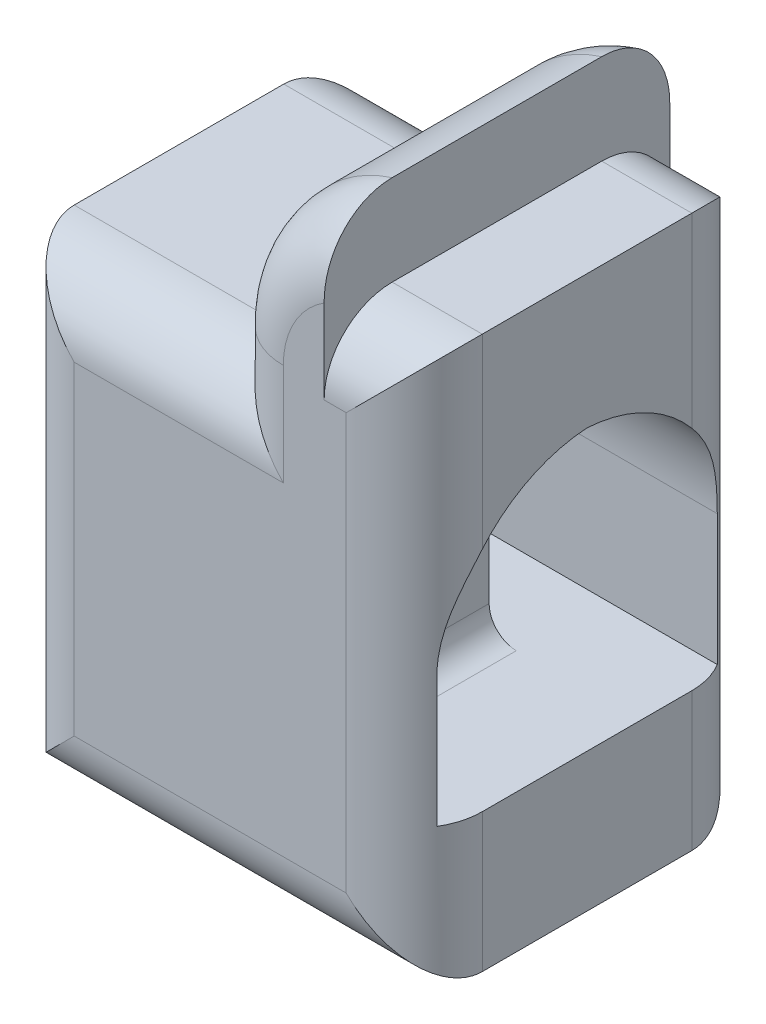
from build123d import *

# Parameters (mm, degrees)
BOSS_EXTRUDE1_DEPTH = 63.5
SKETCH3_W           = 103
SKETCH3_H           = 103
CUT_EXTRUDE1_DEPTH  = 211.692895559
BOSS_EXTRUDE2_DEPTH = 20
FILLET1_R           = 55
SKETCH6_R           = 10
CUT_EXTRUDE2_DEPTH  = 176.866755526
FILLET2_R           = 10
FILLET3_R           = 25


with BuildPart() as part:
    # Sketch2 → Boss-Extrude1 (new, symmetric)
    with BuildSketch(Plane.XY):
        with BuildLine():
            Line((-37.021158778, -102.394460884), (112.91726901, -102.394460884))
            Line((112.91726901, -102.394460884), (112.91726901, 63.318112544))
            Line((112.91726901, 63.318112544), (112.91726901, 100.457569387))
            Line((112.91726901, 100.457569387), (79.814777063, 100.457569387))
            Line((79.814777063, 100.457569387), (79.814777063, 133.707569387))
            ThreePointArc((79.814777063, 133.707569387), (50.885133933, 112.867809308), (39.821527553, 78.973614146))
            Line((39.821527553, 78.973614146), (39.821527553, 66.568112544))
            Line((39.821527553, 66.568112544), (-37.021158778, 66.568112544))
            Line((-37.021158778, 66.568112544), (-37.021158778, -102.394460884))
        make_face()
    extrude(amount=BOSS_EXTRUDE1_DEPTH, both=True)

    # Sketch3 → Cut-Extrude1 (cut, through all)
    with BuildSketch(Plane(origin=(112.91726901, 0, 0), x_dir=(0, 0, -1), z_dir=(1, 0, 0))):
        Rectangle(SKETCH3_W, SKETCH3_H)
    extrude(amount=-CUT_EXTRUDE1_DEPTH, mode=Mode.SUBTRACT)

    # Sketch5 → Boss-Extrude2 (add, symmetric)
    with BuildSketch(Plane.ZY.offset(-37.948055116)):
        with BuildLine():
            Line((19, -51.5), (-19, -51.5))
            Line((-19, -51.5), (-19, -21.5))
            ThreePointArc((-19, -21.5), (0, -2.5), (19, -21.5))
            Line((19, -21.5), (19, -51.5))
        make_face()
    extrude(amount=BOSS_EXTRUDE2_DEPTH, both=True)

    # Fillet1
    # the kernel refuses this fillet: 55 mm, written as the material it adds along each edge
    with BuildSketch(Plane(origin=(112.91726901, 51.5, 51.5), x_dir=(0, 0, -1), z_dir=(-1, 0, 0))) as fillet1_piece_1:
        with BuildLine():
            CenterArc((FILLET1_R, FILLET1_R), FILLET1_R, 180, 90)
            Line((0, FILLET1_R), (0, 0))
            Line((0, 0), (FILLET1_R, 0))
        make_face()
    extrude(amount=149.938427788)
    with BuildSketch(Plane(origin=(112.91726901, 51.5, -51.5), x_dir=(0, 0, 1), z_dir=(-1, 0, 0))) as fillet1_piece_2:
        with BuildLine():
            CenterArc((FILLET1_R, -FILLET1_R), FILLET1_R, 90, 90)
            Line((0, -FILLET1_R), (0, 0))
            Line((0, 0), (FILLET1_R, 0))
        make_face()
    extrude(amount=149.938427788)

    # Sketch6 → Cut-Extrude2 (cut, through all)
    with BuildSketch(Plane.ZY.offset(-17.948055116)):
        with Locations((0, -21.5)):
            Circle(SKETCH6_R)
    extrude(amount=-CUT_EXTRUDE2_DEPTH, mode=Mode.SUBTRACT)

    # Fillet2
    fillet2_edges = [part.edges().sort_by_distance(p)[0] for p in [
        (57.948055116, -51.5, 0),
        (17.948055116, -51.5, 0),
    ]]
    fillet(fillet2_edges, radius=FILLET2_R)

    # Fillet3
    # the kernel refuses this fillet: 25 mm, written as the material it takes off along each edge
    with BuildSketch(Plane(origin=(39.821527553, 78.973614146, -63.5), x_dir=(0, 0, 1), z_dir=(0, -1, 0)), Plane(origin=(39.821527553, 78.973614146, 63.5), x_dir=(1, 0, 0), z_dir=(0, -1, 0))) as fillet3_piece_1:
        with BuildLine():
            CenterArc((FILLET3_R, -FILLET3_R), FILLET3_R, 90, 90)
            Line((0, -FILLET3_R), (0, 0))
            Line((0, 0), (FILLET3_R, 0))
        make_face()
    extrude(amount=12.405501602, mode=Mode.SUBTRACT)
    with BuildSketch(Plane(origin=(97.272046317, 78.973614146, -63.5), x_dir=(0.7028717188946543, 0.711316629060557, 0), z_dir=(0.711316629060557, -0.7028717188946543, 0))) as fillet3_piece_2:
        with BuildLine():
            CenterArc((57.450518764 - FILLET3_R, FILLET3_R), FILLET3_R, 270, 90)
            Line((57.450518764 - FILLET3_R, 0), (57.450518764, 0))
            Line((57.450518764, 0), (57.450518764, FILLET3_R))
        make_face()
    revolve(axis=Axis((97.272046317, 78.973614146, -63.5), (0, 0, 1)), revolution_arc=134.657858898, mode=Mode.SUBTRACT)
    with BuildSketch(Plane(origin=(-99.521158778, -102.394460884, 63.5), x_dir=(0, 0, -1), z_dir=(1, 0, 0))) as fillet3_piece_3:
        with BuildLine():
            CenterArc((FILLET3_R, FILLET3_R), FILLET3_R, 180, 90)
            Line((0, FILLET3_R), (0, 0))
            Line((0, 0), (FILLET3_R, 0))
        make_face()
    extrude(amount=274.938427788, mode=Mode.SUBTRACT)
    with BuildSketch(Plane(origin=(97.272046317, 78.973614146, 63.5), x_dir=(0.7028717188946543, 0.711316629060557, 0), z_dir=(0.711316629060557, -0.7028717188946543, 0))) as fillet3_piece_4:
        with BuildLine():
            CenterArc((57.450518764 - FILLET3_R, -FILLET3_R), FILLET3_R, 0, 90)
            Line((57.450518764, -FILLET3_R), (57.450518764, 0))
            Line((57.450518764, 0), (57.450518764 - FILLET3_R, 0))
        make_face()
    revolve(axis=Axis((97.272046317, 78.973614146, 63.5), (0, 0, 1)), revolution_arc=134.657858898, mode=Mode.SUBTRACT)
    with BuildSketch(Plane(origin=(39.821527553, 66.568112544, 63.5), x_dir=(0, -1, 0), z_dir=(-1, 0, 0)), Plane(origin=(39.821527553, 66.568112544, -63.5), x_dir=(0, 0, 1), z_dir=(-1, 0, 0))) as fillet3_piece_5:
        with BuildLine():
            CenterArc((FILLET3_R, -FILLET3_R), FILLET3_R, 90, 90)
            Line((0, -FILLET3_R), (0, 0))
            Line((0, 0), (FILLET3_R, 0))
        make_face()
    extrude(amount=139.342686331, mode=Mode.SUBTRACT)
    with BuildSketch(Plane(origin=(-37.021158778, 129.068112544, 63.5), x_dir=(0, 0, -1), z_dir=(0, -1, 0))) as fillet3_piece_6:
        with BuildLine():
            CenterArc((FILLET3_R, FILLET3_R), FILLET3_R, 180, 90)
            Line((0, FILLET3_R), (0, 0))
            Line((0, 0), (FILLET3_R, 0))
        make_face()
    extrude(amount=293.962573428, mode=Mode.SUBTRACT)
    with BuildSketch(Plane(origin=(112.91726901, 162.957569387, 63.5), x_dir=(-1, 0, 0), z_dir=(0, -1, 0)), Plane(origin=(112.91726901, -164.894460884, -63.5), x_dir=(-1, 0, 0), z_dir=(0, 1, 0))) as fillet3_piece_7:
        with BuildLine():
            CenterArc((FILLET3_R, FILLET3_R), FILLET3_R, 180, 90)
            Line((0, FILLET3_R), (0, 0))
            Line((0, 0), (FILLET3_R, 0))
        make_face()
    extrude(amount=327.852030272, mode=Mode.SUBTRACT)
    with BuildSketch(Plane(origin=(-99.521158778, -102.394460884, -63.5), x_dir=(0, 0, 1), z_dir=(1, 0, 0))) as fillet3_piece_8:
        with BuildLine():
            CenterArc((FILLET3_R, -FILLET3_R), FILLET3_R, 90, 90)
            Line((0, -FILLET3_R), (0, 0))
            Line((0, 0), (FILLET3_R, 0))
        make_face()
    extrude(amount=274.938427788, mode=Mode.SUBTRACT)
    with BuildSketch(Plane(origin=(-37.021158778, 129.068112544, -63.5), x_dir=(0, 0, 1), z_dir=(0, -1, 0))) as fillet3_piece_9:
        with BuildLine():
            CenterArc((FILLET3_R, -FILLET3_R), FILLET3_R, 90, 90)
            Line((0, -FILLET3_R), (0, 0))
            Line((0, 0), (FILLET3_R, 0))
        make_face()
    extrude(amount=293.962573428, mode=Mode.SUBTRACT)
    with BuildSketch(Plane(origin=(175.41726901, 100.457569387, -63.5), x_dir=(0, 0, 1), z_dir=(-1, 0, 0)), Plane(origin=(175.41726901, 100.457569387, 63.5), x_dir=(0, -1, 0), z_dir=(-1, 0, 0))) as fillet3_piece_10:
        with BuildLine():
            CenterArc((FILLET3_R, -FILLET3_R), FILLET3_R, 90, 90)
            Line((0, -FILLET3_R), (0, 0))
            Line((0, 0), (FILLET3_R, 0))
        make_face()
    extrude(amount=95.602491947, mode=Mode.SUBTRACT)
    with BuildSketch(Plane(origin=(39.821527553, 78.973614146, -63.5), x_dir=(0, 0, 1), z_dir=(0, -1, 0))) as fillet3_piece_11a_section:
        with BuildLine():
            CenterArc((FILLET3_R, -FILLET3_R), FILLET3_R, 90, 90)
            Line((0, -FILLET3_R), (0, 0))
            Line((0, 0), (FILLET3_R, 0))
        make_face()
    fillet3_piece_11a = extrude(amount=74.905501602, mode=Mode.PRIVATE)
    fillet3_piece_11a = split(fillet3_piece_11a, bisect_by=Plane(origin=(45.48140541, 66.568112544, -57.840122143), z_dir=(0, -1, 0)), keep=Keep.TOP, mode=Mode.PRIVATE)
    with BuildSketch(Plane(origin=(102.321527553, 66.568112544, -63.5), x_dir=(0, 0, 1), z_dir=(-1, 0, 0))) as fillet3_piece_11b_section:
        with BuildLine():
            CenterArc((FILLET3_R, -FILLET3_R), FILLET3_R, 90, 90)
            Line((0, -FILLET3_R), (0, 0))
            Line((0, 0), (FILLET3_R, 0))
        make_face()
    fillet3_piece_11b = extrude(amount=201.842686331, mode=Mode.PRIVATE)
    fillet3_piece_11b = split(fillet3_piece_11b, bisect_by=Plane(origin=(39.821527553, 60.908234687, -57.840122143), z_dir=(1, 0, 0)), keep=Keep.TOP, mode=Mode.PRIVATE)
    fillet3_piece_11 = fillet3_piece_11a & fillet3_piece_11b
    add(fillet3_piece_11, mode=Mode.SUBTRACT)
    with BuildSketch(Plane(origin=(39.821527553, 78.973614146, 63.5), x_dir=(1, 0, 0), z_dir=(0, -1, 0))) as fillet3_piece_12a_section:
        with BuildLine():
            CenterArc((FILLET3_R, -FILLET3_R), FILLET3_R, 90, 90)
            Line((0, -FILLET3_R), (0, 0))
            Line((0, 0), (FILLET3_R, 0))
        make_face()
    fillet3_piece_12a = extrude(amount=74.905501602, mode=Mode.PRIVATE)
    fillet3_piece_12a = split(fillet3_piece_12a, bisect_by=Plane(origin=(45.48140541, 66.568112544, 57.840122143), z_dir=(0, -1, 0)), keep=Keep.TOP, mode=Mode.PRIVATE)
    with BuildSketch(Plane(origin=(102.321527553, 66.568112544, 63.5), x_dir=(0, -1, 0), z_dir=(-1, 0, 0))) as fillet3_piece_12b_section:
        with BuildLine():
            CenterArc((FILLET3_R, -FILLET3_R), FILLET3_R, 90, 90)
            Line((0, -FILLET3_R), (0, 0))
            Line((0, 0), (FILLET3_R, 0))
        make_face()
    fillet3_piece_12b = extrude(amount=201.842686331, mode=Mode.PRIVATE)
    fillet3_piece_12b = split(fillet3_piece_12b, bisect_by=Plane(origin=(39.821527553, 60.908234687, 57.840122143), z_dir=(1, 0, 0)), keep=Keep.TOP, mode=Mode.PRIVATE)
    fillet3_piece_12 = fillet3_piece_12a & fillet3_piece_12b
    add(fillet3_piece_12, mode=Mode.SUBTRACT)


solid = part.part
